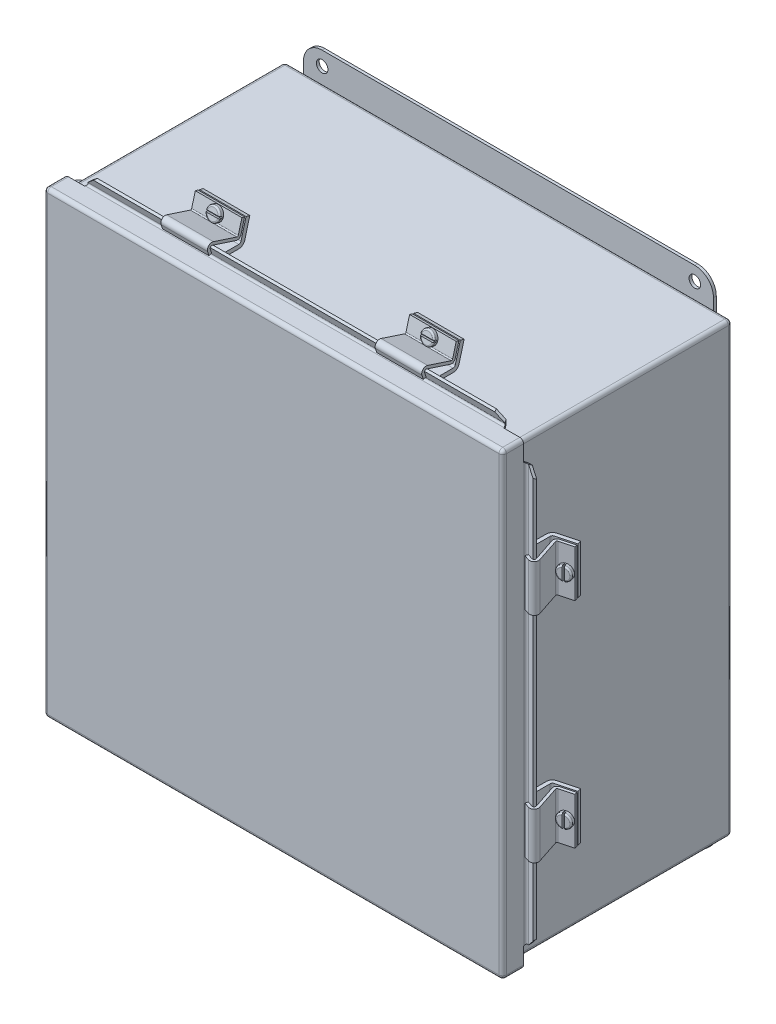
from build123d import *

# Parameters (mm, degrees)
SKETCH1_W                = 304.8
SKETCH1_H                = 304.8
EXTRUDE1_DEPTH           = 152.4
FILLET1_R                = 2.54
SHELL1_T                 = 1.905
CUT_EXTRUDE1_REACH       = 265.965
SKETCH2_W                = 287.02
SKETCH2_H                = 287.02
SKETCH4_W                = 279.4
SKETCH4_H                = 44.45
EXTRUDE2_DEPTH           = 1.905
FILLET2_R                = 12.7
CUT_EXTRUDE3_REACH       = 277.403
SKETCH5_R                = 3.937
FILLET2_OF_MIRROR3_R     = 12.7
SKETCH6_W                = 312.674
SKETCH6_H                = 312.674
EXTRUDE3_DEPTH           = 14.224
FILLET3_R                = 2.54
SHELL2_T                 = -1.905
EXTRUDE4_DEPTH           = 152.527
EXTRUDE4_DEPTH_BACK      = 152.527
CUT_EXTRUDE4_DEPTH       = 286.99039074
CUT_EXTRUDE5_DEPTH       = 288.062321736
EXTRUDE5_DEPTH           = 152.527
CUT_EXTRUDE6_DEPTH       = 286.99039074
CUT_EXTRUDE7_DEPTH       = 286.99039074
MIRROR6_COPY_1_DEPTH     = 286.99039074
MIRROR6_COPY_2_DEPTH     = 286.99039074
EXTRUDE6_DEPTH           = 145.796
EXTRUDE6_DEPTH_BACK      = 145.796
EXTRUDE7_DEPTH           = 145.796
EXTRUDE7_DEPTH_BACK      = 145.796
SKETCH14_W               = 7.874
SKETCH14_H               = 12.7
CUT_EXTRUDE8_DEPTH       = 286.99039074
LPATTERN1_COUNT          = 12
LPATTERN1_PITCH          = 25.4
LPATTERN1_COUNT_DIR2     = 12
LPATTERN1_PITCH_DIR2     = 25.4
SKETCH17_W               = 7.874
SKETCH17_H               = 12.446
CUT_EXTRUDE9_DEPTH       = 286.99039074
LPATTERN9_COUNT          = 13
LPATTERN9_PITCH          = 25.4
LPATTERN9_COUNT_DIR2     = 13
LPATTERN9_PITCH_DIR2     = 25.4
EXTRUDE8_START           = -145.796
SKETCH18_R               = 1.8796
EXTRUDE8_DEPTH           = 291.592
SKETCH19_R               = 5.08
EXTRUDE9_DEPTH           = 11.1125
FILLET4_R                = 0.762
SKETCH37_W               = 1.778
SKETCH37_H               = 11.684
CUT_EXTRUDE15_DEPTH      = 1.27
LPATTERN10_COUNT         = 2
LPATTERN10_PITCH         = 260.35
LPATTERN10_COUNT_DIR2    = 2
LPATTERN10_PITCH_DIR2    = 260.35
FILLET4_OF_LPATTERN10_R  = 0.762
SKETCH22_W               = 276.225
SKETCH22_H               = 273.05
EXTRUDE10_DEPTH          = 1.905
SKETCH23_R               = 3.96875
CUT_EXTRUDE10_DEPTH      = 1.905
EXTRUDE11_DEPTH          = 31.75
EXTRUDE12_DEPTH          = 31.75
CUT_EXTRUDE11_DEPTH      = 311.299809285
CUT_EXTRUDE11_DEPTH_BACK = 311.299809285
SKETCH26_R               = 2.4384
SKETCH28_W               = 1.27
SKETCH28_H               = 9.4742
CUT_EXTRUDE12_DEPTH      = 1.778
EXTRUDE13_DEPTH          = 31.75
EXTRUDE14_DEPTH          = 31.75
SKETCH33_R               = 2.4384
CUT_EXTRUDE13_DEPTH      = 318.112376102
SKETCH35_W               = 9.4742
SKETCH35_H               = 1.27
CUT_EXTRUDE14_DEPTH      = 1.778


with BuildPart() as part:
    # Sketch1 → Extrude1 (new body)
    with BuildSketch(Plane.XY):
        Rectangle(SKETCH1_W, SKETCH1_H)
    extrude(amount=EXTRUDE1_DEPTH)

    # Fillet1
    fillet1_edges = [part.edges().sort_by_distance(p)[0] for p in [
        (152.4, 0, 152.4),
        (0, 152.4, 152.4),
        (-152.4, 0, 152.4),
        (0, 152.4, 0),
        (152.4, 0, 0),
        (0, -152.4, 0),
        (-152.4, 0, 0),
        (0, -152.4, 152.4),
        (-152.4, 152.4, 76.2),
        (152.4, 152.4, 76.2),
        (152.4, -152.4, 76.2),
        (-152.4, -152.4, 76.2),
    ]]
    fillet(fillet1_edges, radius=FILLET1_R)

    # Shell1 (no face opened: a closed hollow body)
    add(offset(amount=-SHELL1_T, mode=Mode.PRIVATE), mode=Mode.SUBTRACT)

    # Sketch2 → Cut-Extrude1 (cut, up to next)
    with BuildSketch(Plane.XY.offset(152.4), mode=Mode.PRIVATE) as cut_extrude1_sk1:
        Rectangle(SKETCH2_W, SKETCH2_H)
    cut_extrude1_tool1 = extrude(cut_extrude1_sk1.sketch, amount=-CUT_EXTRUDE1_REACH, mode=Mode.PRIVATE) & part.part
    add(cut_extrude1_tool1.solids().sort_by_distance((0, 0, 152.4))[0], mode=Mode.SUBTRACT)

    # Sketch4 → Extrude2 (add)
    with BuildSketch(Plane.XY):
        with Locations((0, 149.225)):
            Rectangle(SKETCH4_W, SKETCH4_H)
    extrude2 = extrude(amount=-EXTRUDE2_DEPTH)

    # Fillet2
    fillet2_edges = [part.edges().sort_by_distance(p)[0] for p in [
        (-139.7, 127, -0.9525),
        (-139.7, 171.45, -0.9525),
        (139.7, 171.45, -0.9525),
        (139.7, 127, -0.9525),
    ]]
    fillet(fillet2_edges, radius=FILLET2_R)

    # Sketch5 → Cut-Extrude3 (cut, up to next)
    with BuildSketch(Plane.XY, mode=Mode.PRIVATE) as cut_extrude3_sk1:
        with Locations((-127, 161.925)):
            Circle(SKETCH5_R)
    cut_extrude3_tool1 = extrude(cut_extrude3_sk1.sketch, amount=-CUT_EXTRUDE3_REACH, mode=Mode.PRIVATE) & part.part
    # Sketch5 → Cut-Extrude3 (cut, up to next)
    with BuildSketch(Plane.XY, mode=Mode.PRIVATE) as cut_extrude3_sk2:
        with Locations((127, 161.925)):
            Circle(SKETCH5_R)
    cut_extrude3_tool2 = extrude(cut_extrude3_sk2.sketch, amount=-CUT_EXTRUDE3_REACH, mode=Mode.PRIVATE) & part.part
    cut_extrude3_1 = cut_extrude3_tool1.solids().sort_by_distance((-127, 161.925, 0))[0]
    add(cut_extrude3_1, mode=Mode.SUBTRACT)
    cut_extrude3_2 = cut_extrude3_tool2.solids().sort_by_distance((127, 161.925, 0))[0]
    add(cut_extrude3_2, mode=Mode.SUBTRACT)
    cut_extrude3 = cut_extrude3_1 + cut_extrude3_2  # Cut-Extrude3 as one shape, for the pattern or mirror that repeats it

    # Mirror3: Extrude2, Cut-Extrude3 across plane
    add(extrude2.mirror(Plane.ZX))
    add(cut_extrude3.mirror(Plane.ZX), mode=Mode.SUBTRACT)

    # Fillet2 of Mirror3
    fillet2_of_mirror3_edges = [part.edges().sort_by_distance(p)[0] for p in [
        (-139.7, -127, -0.9525),
        (-139.7, -171.45, -0.9525),
        (139.7, -171.45, -0.9525),
        (139.7, -127, -0.9525),
    ]]
    fillet(fillet2_of_mirror3_edges, radius=FILLET2_OF_MIRROR3_R)

    # Sketch19 → Extrude9 (add)
    with BuildSketch(Plane.XY.offset(1.905)):
        with Locations(Location((-130.175, -130.175, 0), (0, 0, 180))):
            Circle(SKETCH19_R)
    extrude9 = extrude(amount=EXTRUDE9_DEPTH)

    # Fillet4
    fillet4_edges = [part.edges().sort_by_distance(p)[0] for p in [
        (-125.095, -130.175, 1.905),
    ]]
    fillet(fillet4_edges, radius=FILLET4_R)

    # Sketch20 → #10-32 Tapped Hole1 (revolve, cut)
    with BuildSketch(Plane(origin=(-130.175, -130.175, 13.0175), x_dir=(0, -1, 0), z_dir=(1, 0, 0))):
        Polygon((0, 0), (0, 10.738317848), (2.0193, 9.525), (2.0193, 0), align=None)
    f_10_32_tapped_hole1 = revolve(axis=Axis((-130.175, -130.175, 19.3675), (0, 0, -1)), mode=Mode.SUBTRACT)

    # Sketch36 → Revolve3 (revolve)
    with BuildSketch(Plane(origin=(-130.175, 0, 0), x_dir=(0, 0, -1), z_dir=(1, 0, 0))):
        with BuildLine():
            Line((-4.7625, -130.175), (-18.3007, -130.175))
            ThreePointArc((-18.3007, -130.175), (-17.820637268, -127.631470265), (-16.4465, -125.4379))
            Line((-16.4465, -125.4379), (-14.9225, -125.4379))
            Line((-14.9225, -125.4379), (-14.9225, -127.762))
            Line((-14.9225, -127.762), (-4.7625, -127.762))
            Line((-4.7625, -127.762), (-4.7625, -130.175))
        make_face()
    revolve3 = revolve(axis=Axis((-130.175, -130.175, 18.3007), (0, 0, 1)))

    # Sketch37 → Cut-Extrude15 (cut)
    with BuildSketch(Plane.XY.offset(18.3007)):
        with Locations((-130.175, -130.175)):
            Rectangle(SKETCH37_W, SKETCH37_H)
    cut_extrude15 = extrude(amount=-CUT_EXTRUDE15_DEPTH, mode=Mode.SUBTRACT)

    # LPattern10: Extrude9, #10-32 Tapped Hole1, Revolve3, Cut-Extrude15 2 × 2
    with Locations(*[(i * LPATTERN10_PITCH, j * LPATTERN10_PITCH_DIR2, 0) for i in range(LPATTERN10_COUNT) for j in range(LPATTERN10_COUNT_DIR2) if (i, j) != (0, 0)]):
        add(extrude9)
        add(f_10_32_tapped_hole1, mode=Mode.SUBTRACT)
        add(revolve3)
        add(cut_extrude15, mode=Mode.SUBTRACT)

    # Fillet4 of LPattern10
    fillet4_of_lpattern10_edges = [part.edges().sort_by_distance(p)[0] for p in [
        (-125.095, 130.175, 1.905),
        (135.255, -130.175, 1.905),
        (135.255, 130.175, 1.905),
    ]]
    fillet(fillet4_of_lpattern10_edges, radius=FILLET4_OF_LPATTERN10_R)


with BuildPart() as body_2:
    # Sketch6 → Extrude3 (new body)
    with BuildSketch(Plane.XY.offset(160.274)):
        Rectangle(SKETCH6_W, SKETCH6_H)
    extrude(amount=-EXTRUDE3_DEPTH)

    # Fillet3
    fillet3_edges = [body_2.edges().sort_by_distance(p)[0] for p in [
        (0, 156.337, 160.274),
        (156.337, 0, 160.274),
        (0, -156.337, 160.274),
        (-156.337, 0, 160.274),
        (-156.337, 156.337, 153.162),
        (156.337, 156.337, 153.162),
        (156.337, -156.337, 153.162),
        (-156.337, -156.337, 153.162),
    ]]
    fillet(fillet3_edges, radius=FILLET3_R)

    # Shell2
    shell2_openings = [body_2.faces().sort_by_distance(p)[0] for p in [
        (0, 0, 146.05),
    ]]
    offset(amount=SHELL2_T, openings=shell2_openings, kind=Kind.INTERSECTION)

    # Sketch7 → Extrude4 (add, two sides: drawn at the far end of the back side and taken through both)
    with BuildSketch(Plane(origin=(0, 0, 0), x_dir=(1, 0, 0), z_dir=(0, 1, 0)).offset(-EXTRUDE4_DEPTH_BACK)):
        with BuildLine():
            Line((154.432, -146.05), (154.432, -145.669))
            ThreePointArc((154.432, -145.669), (155.745465526, -143.09697465), (158.599127182, -142.652991271))
            Line((158.599127182, -142.652991271), (163.424741149, -144.240394763))
            Line((163.424741149, -144.240394763), (162.82946484, -146.05))
            Line((162.82946484, -146.05), (158.003850873, -144.462596508))
            ThreePointArc((158.003850873, -144.462596508), (156.86238621, -144.64018986), (156.337, -145.669))
            Line((156.337, -145.669), (156.337, -146.05))
            Line((156.337, -146.05), (154.432, -146.05))
        make_face()
    extrude(amount=EXTRUDE4_DEPTH + EXTRUDE4_DEPTH_BACK)

    # Sketch8 → Cut-Extrude4 (cut, through all)
    with BuildSketch(Plane(origin=(0, 0, 0), x_dir=(0, 0, -1), z_dir=(1, 0, 0))):
        Polygon((-146.05, 152.527), (-146.05, 142.748), (-142.494, 140.694942443), (-142.494, 152.527), align=None)
    cut_extrude4 = extrude(amount=CUT_EXTRUDE4_DEPTH, mode=Mode.SUBTRACT)

    # Sketch9 → Cut-Extrude5 (cut, through all)
    with BuildSketch(Plane.XY.offset(160.274)):
        Polygon((157.607, 142.528029547), (163.424741149, 135.777072573), (163.424741149, 143.632943661), align=None)
    cut_extrude5 = extrude(amount=-CUT_EXTRUDE5_DEPTH, mode=Mode.SUBTRACT)

    # Mirror4: Cut-Extrude4, Cut-Extrude5 across plane
    add(cut_extrude4.mirror(Plane.ZX), mode=Mode.SUBTRACT)
    add(cut_extrude5.mirror(Plane.ZX), mode=Mode.SUBTRACT)

    # Sketch10 → Extrude5 (add, symmetric)
    with BuildSketch(Plane(origin=(0, 0, 0), x_dir=(0, 0, -1), z_dir=(1, 0, 0))):
        with BuildLine():
            Line((-146.05, 154.432), (-145.669, 154.432))
            ThreePointArc((-145.669, 154.432), (-143.09697465, 155.745465526), (-142.652991271, 158.599127182))
            Line((-142.652991271, 158.599127182), (-144.240394763, 163.424741149))
            Line((-144.240394763, 163.424741149), (-146.05, 162.82946484))
            Line((-146.05, 162.82946484), (-144.462596508, 158.003850873))
            ThreePointArc((-144.462596508, 158.003850873), (-144.64018986, 156.86238621), (-145.669, 156.337))
            Line((-145.669, 156.337), (-146.05, 156.337))
            Line((-146.05, 156.337), (-146.05, 154.432))
        make_face()
    extrude5 = extrude(amount=EXTRUDE5_DEPTH, both=True)

    # Sketch11 → Cut-Extrude6 (cut, through all)
    with BuildSketch(Plane(origin=(0, 0, 0), x_dir=(1, 0, 0), z_dir=(0, 1, 0))):
        Polygon((-152.527, -146.05), (-143.002, -146.05), (-140.948942443, -142.494), (-152.527, -142.494), align=None)
    cut_extrude6 = extrude(amount=CUT_EXTRUDE6_DEPTH, mode=Mode.SUBTRACT)

    # Sketch12 → Cut-Extrude7 (cut, through all)
    with BuildSketch(Plane.XY):
        Polygon((-136.031072573, 163.424741149), (-143.886943661, 163.424741149), (-142.782029547, 157.607), align=None)
    cut_extrude7 = extrude(amount=CUT_EXTRUDE7_DEPTH, mode=Mode.SUBTRACT)

    # Mirror7: Cut-Extrude6, Cut-Extrude7 across plane
    add(cut_extrude6.mirror(Plane(origin=(0, 0, 0), x_dir=(0, 0, 1), z_dir=(1, 0, 0))), mode=Mode.SUBTRACT)
    add(cut_extrude7.mirror(Plane(origin=(0, 0, 0), x_dir=(0, 0, 1), z_dir=(1, 0, 0))), mode=Mode.SUBTRACT)

    # Mirror6: Extrude5, Cut-Extrude6, Cut-Extrude7 across plane
    add(extrude5.mirror(Plane.ZX))
    add(cut_extrude6.mirror(Plane.ZX), mode=Mode.SUBTRACT)
    add(cut_extrude7.mirror(Plane.ZX), mode=Mode.SUBTRACT)

    # Mirror6 copy 1 sketch → Mirror6 copy 1 (cut, through all)
    with BuildSketch(Plane(origin=(0, 0, 0), x_dir=(-1, 0, 0), z_dir=(0, -1, 0))):
        Polygon((-152.527, -146.05), (-143.002, -146.05), (-140.948942443, -142.494), (-152.527, -142.494), align=None)
    extrude(amount=MIRROR6_COPY_1_DEPTH, mode=Mode.SUBTRACT)

    # Mirror6 copy 2 sketch → Mirror6 copy 2 (cut, through all)
    with BuildSketch(Plane(origin=(0, 0, 0), x_dir=(-1, 0, 0), z_dir=(0, 0, 1))):
        Polygon((-136.031072573, 163.424741149), (-143.886943661, 163.424741149), (-142.782029547, 157.607), align=None)
    extrude(amount=MIRROR6_COPY_2_DEPTH, mode=Mode.SUBTRACT)


with BuildPart() as body_3:
    # Sketch13 → Extrude6 (new, two sides: drawn at the far end of the back side and taken through both)
    with BuildSketch(Plane(origin=(0, 0, 0), x_dir=(1, 0, 0), z_dir=(0, 1, 0)).offset(-EXTRUDE6_DEPTH_BACK)):
        with BuildLine():
            Line((-152.4, -158.369), (-152.4, -136.779))
            ThreePointArc((-152.4, -136.779), (-159.653621474, -134.657681778), (-154.686, -140.353096809))
            Line((-154.686, -140.353096809), (-155.538129032, -138.508401682))
            ThreePointArc((-155.538129032, -138.508401682), (-157.941816842, -135.752555699), (-154.432, -136.779))
            Line((-154.432, -136.779), (-154.432, -158.369))
            Line((-154.432, -158.369), (-152.4, -158.369))
        make_face()
    extrude(amount=EXTRUDE6_DEPTH + EXTRUDE6_DEPTH_BACK)

    # Sketch14 → Cut-Extrude8 (cut, through all)
    with BuildSketch(Plane(origin=(0, 0, 0), x_dir=(0, 0, -1), z_dir=(1, 0, 0))):
        with Locations((-136.779, 0)):
            Rectangle(SKETCH14_W, SKETCH14_H)
    cut_extrude8 = extrude(amount=-CUT_EXTRUDE8_DEPTH, mode=Mode.SUBTRACT)

    # LPattern1: Cut-Extrude8 12 × 12
    with Locations(*[Vector(0, -1, 0) * (i * LPATTERN1_PITCH) + Vector(0, 1, 0) * (j * LPATTERN1_PITCH_DIR2) for i in range(LPATTERN1_COUNT) for j in range(LPATTERN1_COUNT_DIR2) if (i, j) != (0, 0)]):
        add(cut_extrude8, mode=Mode.SUBTRACT)


with BuildPart() as body_4:
    # Sketch16 → Extrude7 (new, two sides: drawn at the far end of the back side and taken through both)
    with BuildSketch(Plane(origin=(0, 0, 0), x_dir=(1, 0, 0), z_dir=(0, 1, 0)).offset(-EXTRUDE7_DEPTH_BACK)):
        with BuildLine():
            Line((-152.4, -136.779), (-152.4, -115.189))
            Line((-152.4, -115.189), (-154.432, -115.189))
            Line((-154.432, -115.189), (-154.432, -136.779))
            ThreePointArc((-154.432, -136.779), (-157.941816842, -137.805444301), (-155.538129032, -135.049598318))
            Line((-155.538129032, -135.049598318), (-154.686, -133.204903191))
            ThreePointArc((-154.686, -133.204903191), (-159.653621474, -138.900318222), (-152.4, -136.779))
        make_face()
    extrude(amount=EXTRUDE7_DEPTH + EXTRUDE7_DEPTH_BACK)

    # Sketch17 → Cut-Extrude9 (cut, through all)
    with BuildSketch(Plane(origin=(0, 0, 0), x_dir=(0, 0, -1), z_dir=(1, 0, 0))):
        with Locations((-136.779, 12.7)):
            Rectangle(SKETCH17_W, SKETCH17_H)
    cut_extrude9 = extrude(amount=-CUT_EXTRUDE9_DEPTH, mode=Mode.SUBTRACT)

    # LPattern9: Cut-Extrude9 13 × 13
    with Locations(*[Vector(0, 1, 0) * (i * LPATTERN9_PITCH) + Vector(0, -1, 0) * (j * LPATTERN9_PITCH_DIR2) for i in range(LPATTERN9_COUNT) for j in range(LPATTERN9_COUNT_DIR2) if (i, j) != (0, 0)]):
        add(cut_extrude9, mode=Mode.SUBTRACT)


with BuildPart() as body_5:
    # Sketch18 → Extrude8 (new body)
    with BuildSketch(Plane(origin=(0, 0, 0), x_dir=(1, 0, 0), z_dir=(0, 1, 0)).offset(EXTRUDE8_START)):
        with Locations(Location((-156.337, -136.779, 0), (0, 0, 90))):
            Circle(SKETCH18_R)
    extrude(amount=EXTRUDE8_DEPTH)


with BuildPart() as body_6:
    # Sketch22 → Extrude10 (new body)
    with BuildSketch(Plane.XY.offset(13.0175)):
        Rectangle(SKETCH22_W, SKETCH22_H)
    extrude(amount=EXTRUDE10_DEPTH)

    # Sketch23 → Cut-Extrude10 (cut)
    with BuildSketch(Plane.XY.offset(14.9225)):
        with Locations((-130.175, 130.175)):
            Circle(SKETCH23_R)
        with Locations((130.175, 130.175)):
            Circle(SKETCH23_R)
        with Locations((130.175, -130.175)):
            Circle(SKETCH23_R)
        with Locations((-130.175, -130.175)):
            Circle(SKETCH23_R)
    extrude(amount=-CUT_EXTRUDE10_DEPTH, mode=Mode.SUBTRACT)


with BuildPart() as body_7:
    # Sketch24 → Extrude11 (new body)
    with BuildSketch(Plane.XZ.offset(88.9)):
        with BuildLine():
            Line((168.346729607, 119.126), (155.506289382, 122.566585589))
            ThreePointArc((155.506289382, 122.566585589), (153.266056151, 124.063461578), (152.4, 126.614780727))
            Line((152.4, 126.614780727), (152.4, 142.494))
            Line((152.4, 142.494), (155.067, 142.494))
            Line((155.067, 142.494), (155.067, 126.614780727))
            ThreePointArc((155.067, 126.614780727), (155.381929509, 125.687028309), (156.196559775, 125.142709767))
            Line((156.196559775, 125.142709767), (169.037, 121.702124179))
            Line((169.037, 121.702124179), (168.346729607, 119.126))
        make_face()
    extrude(amount=-EXTRUDE11_DEPTH)


with BuildPart() as body_8:
    # Sketch25 → Extrude12 (new body)
    with BuildSketch(Plane.XZ.offset(88.9)):
        with BuildLine():
            Line((157.843374883, 146.682620722), (161.462585358, 147.873173341))
            ThreePointArc((161.462585358, 147.873173341), (164.600824916, 147.125331156), (165.346914234, 143.986674408))
            Line((165.346914234, 143.986674408), (160.066078054, 127.963395164))
            ThreePointArc((160.066078054, 127.963395164), (160.119365801, 127.3626935), (160.592566935, 126.988844922))
            Line((160.592566935, 126.988844922), (169.793010431, 124.523593517))
            Line((169.793010431, 124.523593517), (169.29996015, 122.683504818))
            Line((169.29996015, 122.683504818), (160.099516654, 125.148756223))
            ThreePointArc((160.099516654, 125.148756223), (158.443312684, 126.457226246), (158.256805568, 128.55968207))
            Line((158.256805568, 128.55968207), (163.537641749, 144.582961314))
            ThreePointArc((163.537641749, 144.582961314), (163.25341038, 145.77866896), (162.057861668, 146.063568104))
            Line((162.057861668, 146.063568104), (158.438651193, 144.873015485))
            Line((158.438651193, 144.873015485), (157.843374883, 146.682620722))
        make_face()
    extrude(amount=-EXTRUDE12_DEPTH)


with BuildPart() as cut_extrude11_tool:
    # Sketch26 → Cut-Extrude11 (new, two sides: drawn at the far end of the back side and taken through both)
    with BuildSketch(Plane(origin=(42.504873386, 0, 158.630347045), x_dir=(-0.9659258262890676, 0, 0.25881904510252335), z_dir=(-0.25881904510252335, 0, -0.9659258262890676)).offset(-CUT_EXTRUDE11_DEPTH_BACK)):
        with Locations((-127.015876332, -73.025)):
            Circle(SKETCH26_R)
    extrude(amount=CUT_EXTRUDE11_DEPTH + CUT_EXTRUDE11_DEPTH_BACK)


with BuildPart() as body_7_1:
    add(body_7.part)

    # Cut-Extrude11: cut by cut_extrude11_tool
    add(cut_extrude11_tool.part, mode=Mode.SUBTRACT)


with BuildPart() as body_8_1:
    add(body_8.part)

    # Cut-Extrude11: cut by cut_extrude11_tool
    add(cut_extrude11_tool.part, mode=Mode.SUBTRACT)


with BuildPart() as body_9:
    # Sketch27 → Revolve1 (revolve)
    with BuildSketch(Plane(origin=(0, -73.025, 0), x_dir=(-1, 0, 0), z_dir=(0, 1, 0)), mode=Mode.PRIVATE) as revolve1_sk:
        with BuildLine():
            Line((-165.25553641, 116.667280848), (-167.589307739, 125.377034024))
            Line((-167.589307739, 125.377034024), (-169.834215952, 124.775512681))
            Line((-169.834215952, 124.775512681), (-170.294396214, 126.4929288))
            ThreePointArc((-170.294396214, 126.4929288), (-170.192897385, 127.26388895), (-169.575975725, 127.737269589))
            Line((-169.575975725, 127.737269589), (-165.981669133, 128.700361138))
            Line((-165.981669133, 128.700361138), (-162.924757391, 117.291811204))
            Line((-162.924757391, 117.291811204), (-165.25553641, 116.667280848))
        make_face()
    revolve(revolve1_sk.sketch.rotate(Axis((162.924757391, -73.025, 117.291811204), (0.25881904510284987, 0, 0.9659258262889802)), 180), axis=Axis((162.924757391, -73.025, 117.291811204), (0.25881904510284987, 0, 0.9659258262889802)))

    # Sketch28 → Cut-Extrude12 (cut)
    with BuildSketch(Plane(origin=(43.293753835, 0, 161.574488963), x_dir=(0.9659258262890703, 0, -0.25881904510251375), z_dir=(0.25881904510251375, 0, 0.9659258262890703))):
        with Locations((127.015876331, -73.025)):
            Rectangle(SKETCH28_W, SKETCH28_H)
    extrude(amount=-CUT_EXTRUDE12_DEPTH, mode=Mode.SUBTRACT)


with BuildPart() as body_10:
    # Sketch31 → Extrude13 (new body)
    with BuildSketch(Plane(origin=(88.9, 0, 0), x_dir=(0, 0, -1), z_dir=(1, 0, 0))):
        with BuildLine():
            Line((-142.494, 152.4), (-126.614780727, 152.4))
            ThreePointArc((-126.614780727, 152.4), (-124.063461578, 153.266056151), (-122.566585589, 155.506289382))
            Line((-122.566585589, 155.506289382), (-119.126, 168.346729607))
            Line((-119.126, 168.346729607), (-121.702124179, 169.037))
            Line((-121.702124179, 169.037), (-125.142709767, 156.196559775))
            ThreePointArc((-125.142709767, 156.196559775), (-125.687028309, 155.381929509), (-126.614780727, 155.067))
            Line((-126.614780727, 155.067), (-142.494, 155.067))
            Line((-142.494, 155.067), (-142.494, 152.4))
        make_face()
    extrude(amount=-EXTRUDE13_DEPTH)


with BuildPart() as body_11:
    # Sketch32 → Extrude14 (new body)
    with BuildSketch(Plane(origin=(88.9, 0, 0), x_dir=(0, 0, -1), z_dir=(1, 0, 0))):
        with BuildLine():
            Line((-122.683504818, 169.29996015), (-125.148756223, 160.099516654))
            ThreePointArc((-125.148756223, 160.099516654), (-126.457226246, 158.443312684), (-128.55968207, 158.256805568))
            Line((-128.55968207, 158.256805568), (-144.582961314, 163.537641749))
            ThreePointArc((-144.582961314, 163.537641749), (-145.77866896, 163.25341038), (-146.063568104, 162.057861668))
            Line((-146.063568104, 162.057861668), (-145.071440921, 159.041852939))
            Line((-145.071440921, 159.041852939), (-146.881046159, 158.446576629))
            Line((-146.881046159, 158.446576629), (-147.873173341, 161.462585358))
            ThreePointArc((-147.873173341, 161.462585358), (-147.125331156, 164.600824916), (-143.986674408, 165.346914234))
            Line((-143.986674408, 165.346914234), (-127.963395164, 160.066078054))
            ThreePointArc((-127.963395164, 160.066078054), (-127.3626935, 160.119365801), (-126.988844922, 160.592566935))
            Line((-126.988844922, 160.592566935), (-124.523593517, 169.793010431))
            Line((-124.523593517, 169.793010431), (-122.683504818, 169.29996015))
        make_face()
    extrude(amount=-EXTRUDE14_DEPTH)


with BuildPart() as cut_extrude13_tool:
    # Sketch33 → Cut-Extrude13 (new, through all)
    with BuildSketch(Plane(origin=(0, 42.504873386, 158.630347045), x_dir=(1, 0, 0), z_dir=(0, 0.2588190451026369, 0.9659258262890371))):
        with Locations(Location((73.025, 127.015876332, 0), (0, 0, 270))):
            Circle(SKETCH33_R)
    extrude(amount=-CUT_EXTRUDE13_DEPTH)


with BuildPart() as body_11_1:
    add(body_11.part)

    # Cut-Extrude13: cut by cut_extrude13_tool
    add(cut_extrude13_tool.part, mode=Mode.SUBTRACT)


with BuildPart() as body_10_1:
    add(body_10.part)

    # Cut-Extrude13: cut by cut_extrude13_tool
    add(cut_extrude13_tool.part, mode=Mode.SUBTRACT)


with BuildPart() as body_12:
    # Sketch34 → Revolve2 (revolve)
    with BuildSketch(Plane(origin=(73.025, 0, 0), x_dir=(0, 0, -1), z_dir=(1, 0, 0))):
        with BuildLine():
            Line((-117.291811204, 162.924757391), (-128.700361138, 165.981669133))
            Line((-128.700361138, 165.981669133), (-127.737269589, 169.575975725))
            ThreePointArc((-127.737269589, 169.575975725), (-127.26388895, 170.192897385), (-126.4929288, 170.294396214))
            Line((-126.4929288, 170.294396214), (-124.775512681, 169.834215952))
            Line((-124.775512681, 169.834215952), (-125.377034024, 167.589307739))
            Line((-125.377034024, 167.589307739), (-116.667280848, 165.25553641))
            Line((-116.667280848, 165.25553641), (-117.291811204, 162.924757391))
        make_face()
    revolve(axis=Axis((73.025, 162.924757391, 117.291811204), (0, 0.2588190451025206, 0.9659258262890684)))

    # Sketch35 → Cut-Extrude14 (cut)
    with BuildSketch(Plane(origin=(0, 43.293753835, 161.574488963), x_dir=(1, 0, 0), z_dir=(0, 0.2588190451025565, 0.9659258262890589))):
        with Locations((73.025, 127.015876332)):
            Rectangle(SKETCH35_W, SKETCH35_H)
    extrude(amount=-CUT_EXTRUDE14_DEPTH, mode=Mode.SUBTRACT)


with BuildPart() as body_13:
    # Mirror9: mirrored copy
    add(body_9.part.mirror(Plane.ZX))


with BuildPart() as body_14:
    # Mirror9 2: mirrored copy
    add(body_7_1.part.mirror(Plane.ZX))


with BuildPart() as body_15:
    # Mirror9 3: mirrored copy
    add(body_8_1.part.mirror(Plane.ZX))


with BuildPart() as body_16:
    # Mirror8: mirrored copy
    add(body_12.part.mirror(Plane(origin=(0, 0, 0), x_dir=(0, 0, 1), z_dir=(1, 0, 0))))


with BuildPart() as body_17:
    # Mirror8 2: mirrored copy
    add(body_10_1.part.mirror(Plane(origin=(0, 0, 0), x_dir=(0, 0, 1), z_dir=(1, 0, 0))))


with BuildPart() as body_18:
    # Mirror8 3: mirrored copy
    add(body_11_1.part.mirror(Plane(origin=(0, 0, 0), x_dir=(0, 0, 1), z_dir=(1, 0, 0))))


with BuildPart() as body_2_1:
    add(body_2.part)

    # Combine3: read off the stored shape, not the designer's step
    # Combine3: union body 3
    add(body_3.part)


with BuildPart() as body_18_2:
    # Mirror10: mirrored copy
    add(body_10_1.part.mirror(Plane.ZX))


with BuildPart() as body_19:
    # Mirror10 2: mirrored copy
    add(body_12.part.mirror(Plane.ZX))


with BuildPart() as body_20:
    # Mirror10 3: mirrored copy
    add(body_11_1.part.mirror(Plane.ZX))


with BuildPart() as body_21:
    # Mirror10 4: mirrored copy
    add(body_18.part.mirror(Plane.ZX))


with BuildPart() as body_22:
    # Mirror10 5: mirrored copy
    add(body_16.part.mirror(Plane.ZX))


with BuildPart() as body_23:
    # Mirror10 6: mirrored copy
    add(body_17.part.mirror(Plane.ZX))


solid = Compound([part.part, body_4.part, body_5.part, body_6.part, body_7_1.part, body_8_1.part, body_9.part, body_11_1.part, body_10_1.part, body_12.part, body_13.part, body_14.part, body_15.part, body_16.part, body_17.part, body_18.part, body_2_1.part, body_18_2.part, body_19.part, body_20.part, body_21.part, body_22.part, body_23.part])
